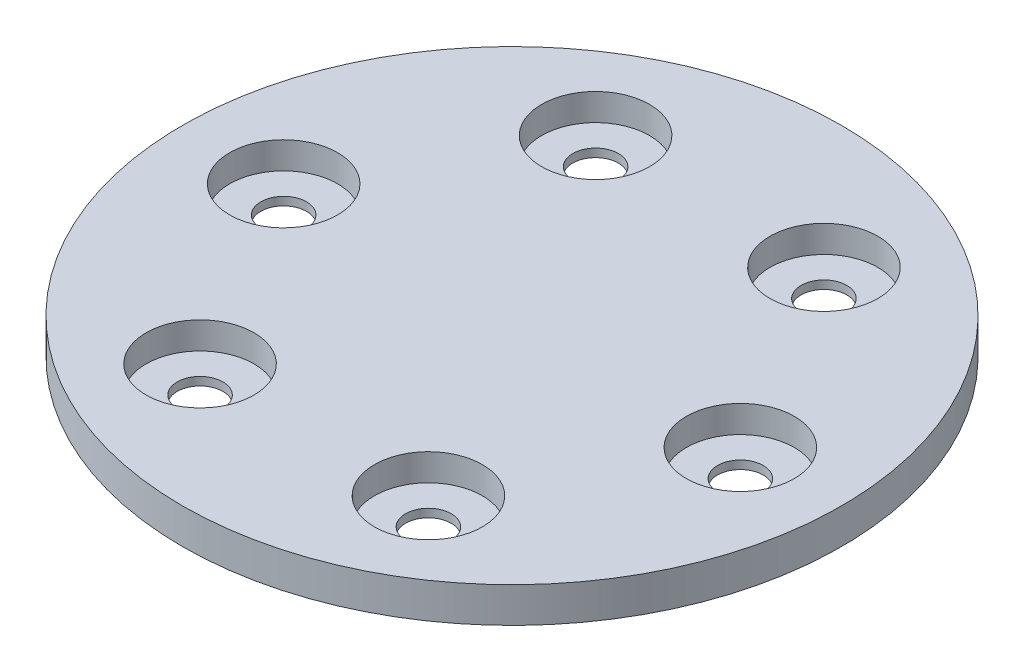
from build123d import *

# Parameters (mm, degrees)
SKETCH1_R           = 15.875
BOSS_EXTRUDE1_DEPTH = 1.7
CIRPATTERN1_COUNT   = 6


with BuildPart() as part:
    # Sketch1 → Boss-Extrude1 (new body)
    with BuildSketch(Plane(origin=(0, 0, 0), x_dir=(1, 0, 0), z_dir=(0, 1, 0))):
        Circle(SKETCH1_R)
    extrude(amount=BOSS_EXTRUDE1_DEPTH)

    # Sketch14 → CBORE for M5 Hex Head Bolt1 (revolve, cut)
    with BuildSketch(Plane(origin=(-11, 1.7, 0), x_dir=(0, 0, 1), z_dir=(1, 0, 0))):
        Polygon((0, 0), (0, 5.660946681), (1.1, 5), (1.1, 1.3), (2.6, 1.3), (2.6, 0), align=None)
    cbore_for_m5_hex_head_bolt1 = revolve(axis=Axis((-11, 8.05, 0), (0, -1, 0)), mode=Mode.SUBTRACT)

    # CirPattern1: CBORE for M5 Hex Head Bolt1 ×6 about axis
    cirpattern1_axis = Axis((0, 1.7, 0), (0, 1, 0))
    for i in range(1, CIRPATTERN1_COUNT):
        add(cbore_for_m5_hex_head_bolt1.rotate(cirpattern1_axis, i * 360 / CIRPATTERN1_COUNT), mode=Mode.SUBTRACT)


solid = part.part
